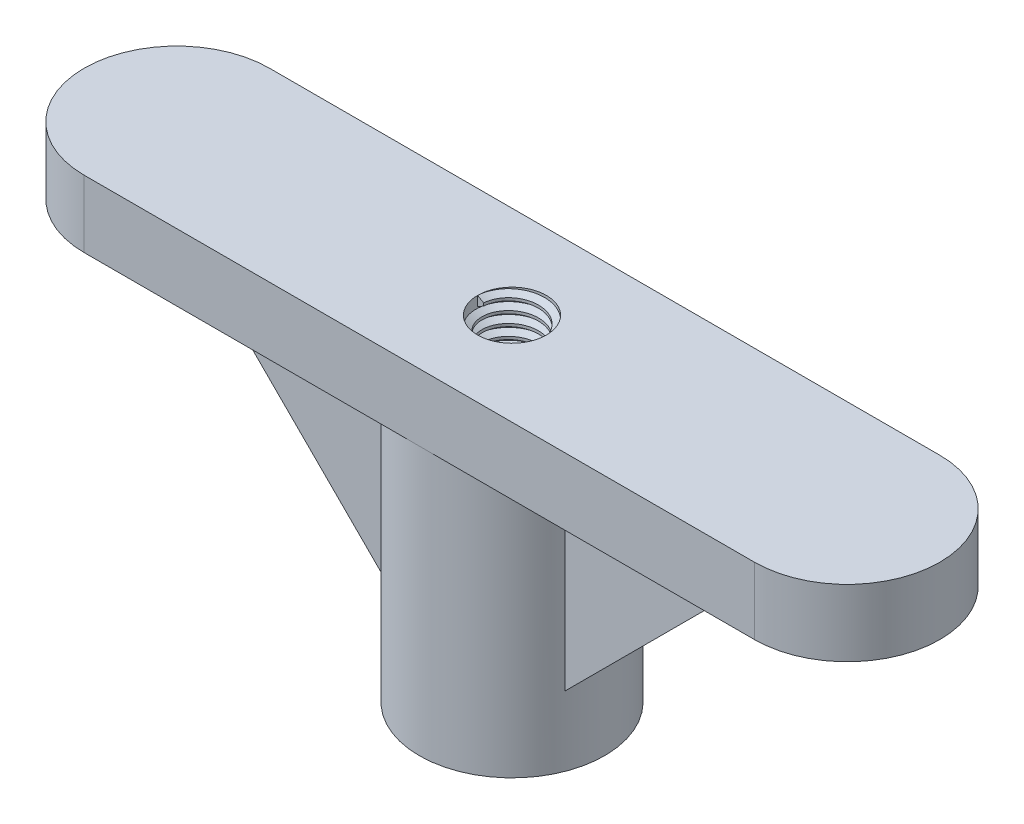
from build123d import *

# Parameters (mm, degrees)
SKETCH1_R           = 17.554199216
SKETCH1_R_2         = 6.512777969
BOSS_EXTRUDE1_DEPTH = 50.8
SKETCH2_R           = 6.512777969
BOSS_EXTRUDE2_DEPTH = 12.7
BOSS_EXTRUDE3_DEPTH = 6.35
THREAD1_PITCH       = 2.116666667


with BuildPart() as part:
    # Sketch1 → Boss-Extrude1 (new body)
    with BuildSketch(Plane(origin=(0, 0, 0), x_dir=(1, 0, 0), z_dir=(0, 1, 0))):
        with Locations(Location((0, 0, 0), (0, 0, 270))):
            Circle(SKETCH1_R)
        with Locations(Location((0, 0, 0), (0, 0, 270))):
            Circle(SKETCH1_R_2, mode=Mode.SUBTRACT)
    extrude(amount=BOSS_EXTRUDE1_DEPTH)

    # Sketch2 → Boss-Extrude2 (add)
    with BuildSketch(Plane(origin=(0, 50.8, 0), x_dir=(1, 0, 0), z_dir=(0, 1, 0))):
        with BuildLine():
            Line((-63.5, 17.554199216), (63.5, 17.554199216))
            ThreePointArc((63.5, 17.554199216), (81.054199216, 0), (63.5, -17.554199216))
            Line((63.5, -17.554199216), (-63.5, -17.554199216))
            ThreePointArc((-63.5, -17.554199216), (-81.054199216, 0), (-63.5, 17.554199216))
        make_face()
        with Locations(Location((0, 0, 0), (0, 0, 270))):
            Circle(SKETCH2_R, mode=Mode.SUBTRACT)
    extrude(amount=BOSS_EXTRUDE2_DEPTH)

    # Sketch3 → Boss-Extrude3 (add, symmetric)
    with BuildSketch(Plane.XY):
        Polygon((-53.975, 50.8), (-15.875, 12.7), (-15.875, 50.8), align=None)
        Polygon((15.875, 12.7), (15.875, 50.8), (53.975, 50.8), align=None)
    extrude(amount=BOSS_EXTRUDE3_DEPTH, both=True)

    # Thread1: the profile of Thread Profile1 profile screwed along a right-hand helix of 30 turns, 10 arcs to a turn; built about Z, then put on its axis
    thread1_z = Axis((0, 0, 0), (0, 0, 1))
    thread1_corners = [(6.513077969, 0, -0.000173205), (6.513077969, 0, 1.852256533), (5.367098534, 0, 1.190624997), (5.367098534, 0, 0.66145833)]
    with BuildLine(mode=Mode.PRIVATE) as thread1_profile:
        Line(thread1_corners[0], thread1_corners[1])
        Line(thread1_corners[1], thread1_corners[2])
        Line(thread1_corners[2], thread1_corners[3])
        Line(thread1_corners[3], thread1_corners[0])
    thread1_cap = Face(thread1_profile.wire())
    thread1_turn_angles = [0, 18, 36, 54, 72, 90, 108, 126, 144, 162, 180, 198, 216, 234, 252, 270, 288, 306, 324, 342, 360]
    thread1_turn_weights = [1, 0.9510565162951535, 1, 0.9510565162951535, 1, 0.9510565162951535, 1, 0.9510565162951535, 1, 0.9510565162951535, 1, 0.9510565162951535, 1, 0.9510565162951535, 1, 0.9510565162951535, 1, 0.9510565162951535, 1, 0.9510565162951535, 1]
    thread1_turn_rails = [Edge.make_bspline([Vector(p[0], p[1], 0).rotate(thread1_z, thread1_turn_angles[k]) / thread1_turn_weights[k] + Vector(0, 0, p[2] + THREAD1_PITCH * thread1_turn_angles[k] / 360) for k in range(21)], [0, 0, 0, 1, 1, 2, 2, 3, 3, 4, 4, 5, 5, 6, 6, 7, 7, 8, 8, 9, 9, 10, 10, 10], 2, thread1_turn_weights) for p in thread1_corners]
    thread1_turn_sides = [Face.make_surface_from_curves(thread1_turn_rails[p[0]], thread1_turn_rails[p[1]]) for p in [(0, 1), (1, 2), (2, 3), (3, 0)]]
    thread1 = Plane(origin=(0, 63.5, 0), x_dir=(-1, 0, 0), z_dir=(0, -1, 0)) * Solid(Shell([*[p.moved(Location((0, 0, THREAD1_PITCH * i))) for i in range(30) for p in thread1_turn_sides], thread1_cap, thread1_cap.rotate(thread1_z, 10800).moved(Location((0, 0, THREAD1_PITCH * 10800 / 360)))]))
    add(thread1)


solid = part.part
